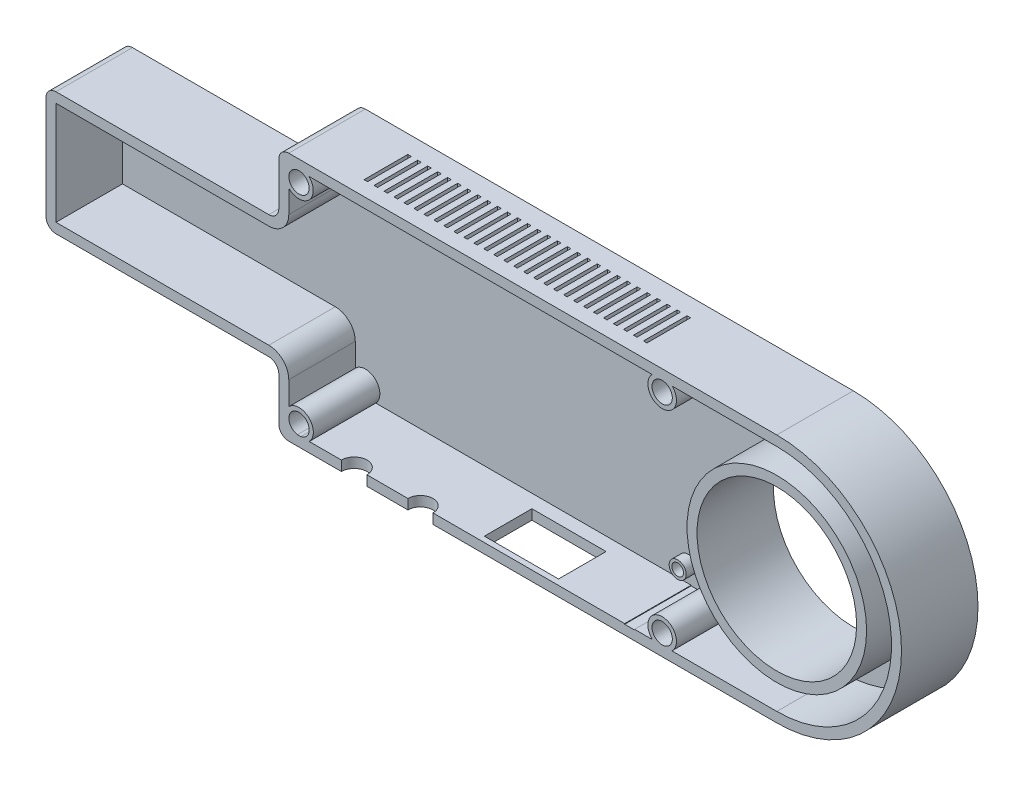
from build123d import *

# Parameters (mm, degrees)
BOSS_EXTRUDE1_DEPTH            = 23
FILLET1_R                      = 3
SHELL2_START                   = 3
SHELL2_DEPTH                   = 20
CUT_EXTRUDE1_START             = 3
SKETCH2_W                      = 3
SKETCH2_H                      = 69.184745233
CUT_EXTRUDE1_DEPTH             = 20
SKETCH4_R                      = 24
BOSS_EXTRUDE2_DEPTH            = 23
SHELL4_START                   = 3
SHELL4_OUTLINE_R               = 27
SHELL4_DEPTH                   = 20
SKETCH7_W                      = 3
SKETCH7_H                      = 69
CUT_EXTRUDE3_DEPTH             = 20
SKETCH8_R                      = 2.805971454
BOSS_EXTRUDE3_DEPTH            = 3
CUT_EXTRUDE4_START             = -1.5
SKETCH8_4_R                    = 1.75
CUT_EXTRUDE4_DEPTH             = 4.5
SKETCH8_5_R                    = 2.557992723
BOSS_EXTRUDE4_DEPTH            = 3
CUT_EXTRUDE5_START             = -1.5
SKETCH8_6_R                    = 1.75
CUT_EXTRUDE5_DEPTH             = 4.5
CUT_EXTRUDE6_REACH             = 157.06
CUT_EXTRUDE6_DIRECTION_2_DEPTH = 156.060294953
CUT_EXTRUDE7_REACH             = 157.06
CUT_EXTRUDE8_REACH             = 157.06
SKETCH17_W                     = 1.055300843
SKETCH17_H                     = 13.135454955
LPATTERN1_COUNT                = 29
LPATTERN1_PITCH                = 3
SKETCH19_R                     = 4.3
SKETCH19_R_2                   = 3.051675087
BOSS_EXTRUDE5_DEPTH            = 20
SKETCH21_W                     = 22.3
SKETCH21_H                     = 14.3
CUT_EXTRUDE9_DEPTH             = 11


# Read off the part's stored shape, not the designer's step: Shell2, Shell4
with BuildPart() as part:
    # Sketch1 → Boss-Extrude1 (new body)
    with BuildSketch(Plane.XY):
        Polygon((-53.5, -18.5), (-53.5, -37.5), (53.5, -37.5), (53.5, 37.5), (-53.5, 37.5), (-53.5, 18.5), (-123.5, 18.5), (-123.5, -18.5), align=None)
    extrude(amount=BOSS_EXTRUDE1_DEPTH)

    # Fillet1
    fillet1_edges = [part.edges().sort_by_distance(p)[0] for p in [
        (-53.5, -37.5, 11.5),
        (-53.5, -18.5, 11.5),
        (-123.5, -18.5, 11.5),
        (-123.5, 18.5, 11.5),
        (-53.5, 18.5, 11.5),
        (-53.5, 37.5, 11.5),
    ]]
    fillet(fillet1_edges, radius=FILLET1_R)

    # Shell2 outline → Shell2 (cut)
    with BuildSketch(Plane.XY.offset(SHELL2_START)):
        with BuildLine():
            Line((50.5, -34.5), (50.5, 34.5))
            Line((50.5, 34.5), (-50.5, 34.5))
            Line((-50.5, 34.5), (-50.5, 21.5))
            ThreePointArc((-50.5, 21.5), (-52.257359313, 17.257359313), (-56.5, 15.5))
            Line((-56.5, 15.5), (-120.5, 15.5))
            Line((-120.5, 15.5), (-120.5, -15.5))
            Line((-120.5, -15.5), (-56.5, -15.5))
            ThreePointArc((-56.5, -15.5), (-52.257359313, -17.257359313), (-50.5, -21.5))
            Line((-50.5, -21.5), (-50.5, -34.5))
            Line((-50.5, -34.5), (50.5, -34.5))
        make_face()
    extrude(amount=SHELL2_DEPTH, mode=Mode.SUBTRACT)

    # Sketch2 → Cut-Extrude1 (cut)
    with BuildSketch(Plane.XY.offset(CUT_EXTRUDE1_START)):
        with Locations((52, -0.092372617)):
            Rectangle(SKETCH2_W, SKETCH2_H)
    extrude(amount=CUT_EXTRUDE1_DEPTH, mode=Mode.SUBTRACT)

    # Sketch4 → Boss-Extrude2 (add)
    with BuildSketch(Plane.XY):
        with BuildLine():
            Line((53.5, 37.5), (96.25236473, 37.5))
            ThreePointArc((96.25236473, 37.5), (133.75236473, 0), (96.25236473, -37.5))
            Line((96.25236473, -37.5), (53.5, -37.5))
            Line((53.5, -37.5), (53.5, 37.5))
        make_face()
        with Locations((96.25236473, 0)):
            Circle(SKETCH4_R, mode=Mode.SUBTRACT)
    extrude(amount=BOSS_EXTRUDE2_DEPTH)

    # Shell4 outline → Shell4 (cut)
    with BuildSketch(Plane.XY.offset(SHELL4_START)):
        with BuildLine():
            Line((96.25236473, 34.5), (56.5, 34.5))
            Line((56.5, 34.5), (56.5, -34.5))
            Line((56.5, -34.5), (96.25236473, -34.5))
            ThreePointArc((96.25236473, -34.5), (130.75236473, 0), (96.25236473, 34.5))
        make_face()
        with Locations((96.25236473, 0)):
            Circle(SHELL4_OUTLINE_R, mode=Mode.SUBTRACT)
    extrude(amount=SHELL4_DEPTH, mode=Mode.SUBTRACT)

    # Sketch7 → Cut-Extrude3 (cut)
    with BuildSketch(Plane.XY.offset(23)):
        with Locations((55, 0)):
            Rectangle(SKETCH7_W, SKETCH7_H)
    extrude(amount=-CUT_EXTRUDE3_DEPTH, mode=Mode.SUBTRACT)

    # Sketch8 → Boss-Extrude3 (add)
    with BuildSketch(Plane.XY.offset(3)):
        with Locations((-38.441003365, 28.065313733)):
            Circle(SKETCH8_R)
    extrude(amount=BOSS_EXTRUDE3_DEPTH)

    # Sketch8<4> → Cut-Extrude4 (cut)
    with BuildSketch(Plane.XY.offset(3).offset(CUT_EXTRUDE4_START)):
        with Locations((-38.441003365, 28.065313733)):
            Circle(SKETCH8_4_R)
    extrude(amount=CUT_EXTRUDE4_DEPTH, mode=Mode.SUBTRACT)

    # Sketch8<5> → Boss-Extrude4 (add)
    with BuildSketch(Plane.XY.offset(3)):
        with Locations((49.442996635, -29.465686267)):
            Circle(SKETCH8_5_R)
    extrude(amount=BOSS_EXTRUDE4_DEPTH)

    # Sketch8<6> → Cut-Extrude5 (cut)
    with BuildSketch(Plane.XY.offset(3).offset(CUT_EXTRUDE5_START)):
        with Locations((49.442996635, -29.465686267)):
            Circle(SKETCH8_6_R)
    extrude(amount=CUT_EXTRUDE5_DEPTH, mode=Mode.SUBTRACT)

    # Sketch13 → Cut-Extrude6 (cut, up to next)
    with BuildSketch(Plane.XZ.offset(37.5), mode=Mode.PRIVATE) as cut_extrude6_sk1:
        with BuildLine():
            Line((-26.973516831, 23), (-34.680588124, 23))
            ThreePointArc((-34.680588124, 23), (-30.827052477, 19.146464354), (-26.973516831, 23))
        make_face()
    cut_extrude6_tool1 = extrude(cut_extrude6_sk1.sketch, amount=-CUT_EXTRUDE6_REACH, mode=Mode.PRIVATE) & part.part
    add(cut_extrude6_tool1.solids().sort_by_distance((-30.827052, -37.5, 21.364509))[0], mode=Mode.SUBTRACT)

    # Sketch13 → Cut-Extrude6 direction 2 (cut)
    with BuildSketch(Plane.XZ.offset(37.5)):
        with BuildLine():
            Line((-26.973516831, 23), (-34.680588124, 23))
            ThreePointArc((-34.680588124, 23), (-30.827052477, 19.146464354), (-26.973516831, 23))
        make_face()
    extrude(amount=CUT_EXTRUDE6_DIRECTION_2_DEPTH, mode=Mode.SUBTRACT)

    # Sketch13<3> → Cut-Extrude7 (cut, up to next)
    with BuildSketch(Plane.XZ.offset(37.5), mode=Mode.PRIVATE) as cut_extrude7_sk1:
        with BuildLine():
            Line((-7.135901681, 23), (-14.677330281, 23))
            ThreePointArc((-14.677330281, 23), (-10.906615981, 19.23699771), (-7.135901681, 23))
        make_face()
    cut_extrude7_tool1 = extrude(cut_extrude7_sk1.sketch, amount=-CUT_EXTRUDE7_REACH, mode=Mode.PRIVATE) & part.part
    add(cut_extrude7_tool1.solids().sort_by_distance((-10.906616, -37.5, 21.403203))[0], mode=Mode.SUBTRACT)

    # Sketch17 → Cut-Extrude8 (cut, up to next)
    with BuildSketch(Plane(origin=(0, 37.5, 0), x_dir=(1, 0, 0), z_dir=(0, 1, 0)), mode=Mode.PRIVATE) as cut_extrude8_sk1:
        with Locations((-31.751673331, -12.007961699)):
            Rectangle(SKETCH17_W, SKETCH17_H)
    cut_extrude8_tool1 = extrude(cut_extrude8_sk1.sketch, amount=-CUT_EXTRUDE8_REACH, mode=Mode.PRIVATE) & part.part
    cut_extrude8 = cut_extrude8_tool1.solids().sort_by_distance((-31.751673, 37.5, 12.007962))[0]
    add(cut_extrude8, mode=Mode.SUBTRACT)

    # LPattern1: Cut-Extrude8 ×29
    with Locations(*[(i * LPATTERN1_PITCH, 0, 0) for i in range(1, LPATTERN1_COUNT)]):
        add(cut_extrude8, mode=Mode.SUBTRACT)

    # Sketch19 → Boss-Extrude5 (add)
    # profile 1 of 4: a face of its own
    with BuildSketch(Plane.XY.offset(3)):
        with Locations((-47.431025643, 31.425786946)):
            Circle(SKETCH19_R)
        with Locations((-47.431025643, 31.425786946)):
            Circle(SKETCH19_R_2, mode=Mode.SUBTRACT)
    # profile 2 of 4: a face of its own
    with BuildSketch(Plane.XY.offset(3)):
        with Locations((-47.407650962, -31.49020456)):
            Circle(SKETCH19_R)
        with Locations((-47.407650962, -31.49020456)):
            Circle(SKETCH19_R_2, mode=Mode.SUBTRACT)
    # profile 3 of 4: a face of its own
    with BuildSketch(Plane.XY.offset(3)):
        with Locations((61.783104826, -31.350542021)):
            Circle(SKETCH19_R)
        with Locations((61.783104826, -31.350542021)):
            Circle(SKETCH19_R_2, mode=Mode.SUBTRACT)
    # profile 4 of 4: a face of its own
    with BuildSketch(Plane.XY.offset(3)):
        with Locations((61.783104826, 31.425786946)):
            Circle(SKETCH19_R)
        with Locations((61.783104826, 31.425786946)):
            Circle(SKETCH19_R_2, mode=Mode.SUBTRACT)
    extrude(amount=BOSS_EXTRUDE5_DEPTH)

    # Sketch21 → Cut-Extrude9 (cut)
    with BuildSketch(Plane.XZ.offset(37.5)):
        with Locations((17.791946099, 14.178990278)):
            Rectangle(SKETCH21_W, SKETCH21_H)
    extrude(amount=-CUT_EXTRUDE9_DEPTH, mode=Mode.SUBTRACT)


solid = part.part
